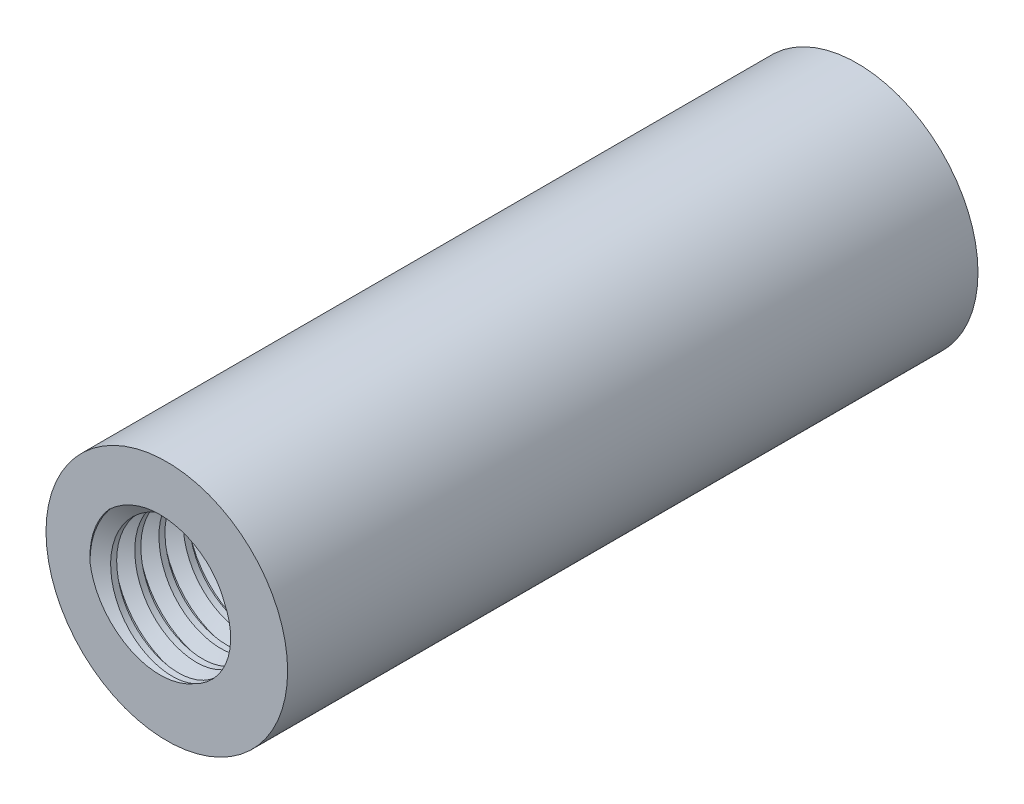
from build123d import *

# Parameters (mm, degrees)
SKETCH_1_R          = 3.5
EXTRUDE_1_DEPTH     = 20
M4X0_7_HELICOIL_1_D = 3.7
THREAD_1_PITCH      = 0.7


with BuildPart() as part:
    # Sketch 1 → 보스-돌출1 (new body)
    with BuildSketch(Plane.XY):
        Circle(SKETCH_1_R)
    extrude(amount=EXTRUDE_1_DEPTH)

    # M4x0.7 Helicoil용 탭 구멍1 (through all)
    with Locations(Plane.XY.offset(20)):
        with Locations((0, 0)):
            Hole(M4X0_7_HELICOIL_1_D / 2)

    # 나사산1: the profile of Sketch 1 2 profile screwed along a right-hand helix of 35.714286 turns, 6 arcs to a turn; built about Z, then put on its axis
    thread_1_z = Axis((0, 0, 0), (0, 0, 1))
    thread_1_corners = [(1.8497, 0, -0.000173205), (2.228886112, 0, 0.218749999), (2.228886112, 0, 0.306249999), (1.8497, 0, 0.525173203)]
    with BuildLine(mode=Mode.PRIVATE) as thread_1_profile:
        Line(thread_1_corners[0], thread_1_corners[1])
        Line(thread_1_corners[1], thread_1_corners[2])
        Line(thread_1_corners[2], thread_1_corners[3])
        Line(thread_1_corners[3], thread_1_corners[0])
    thread_1_cap = Face(thread_1_profile.wire())
    thread_1_turn_angles = [0, 30, 60, 90, 120, 150, 180, 210, 240, 270, 300, 330, 360]
    thread_1_turn_weights = [1, 0.8660254037844387, 1, 0.8660254037844387, 1, 0.8660254037844387, 1, 0.8660254037844387, 1, 0.8660254037844387, 1, 0.8660254037844387, 1]
    thread_1_turn_rails = [Edge.make_bspline([Vector(p[0], p[1], 0).rotate(thread_1_z, thread_1_turn_angles[k]) / thread_1_turn_weights[k] + Vector(0, 0, p[2] + THREAD_1_PITCH * thread_1_turn_angles[k] / 360) for k in range(13)], [0, 0, 0, 1, 1, 2, 2, 3, 3, 4, 4, 5, 5, 6, 6, 6], 2, thread_1_turn_weights) for p in thread_1_corners]
    thread_1_turn_sides = [Face.make_surface_from_curves(thread_1_turn_rails[p[0]], thread_1_turn_rails[p[1]]) for p in [(0, 1), (1, 2), (2, 3), (3, 0)]]
    thread_1_last_angles = [12600, 12630, 12660, 12690, 12720, 12750, 12780, 12810, 12840, 12848.571428571, 12857.142857143]
    thread_1_last_weights = [1, 0.8660254037844387, 1, 0.8660254037844387, 1, 0.8660254037844387, 1, 0.8660254037844387, 1, 0.9888308262251265, 1]
    thread_1_last_rails = [Edge.make_bspline([Vector(p[0], p[1], 0).rotate(thread_1_z, thread_1_last_angles[k]) / thread_1_last_weights[k] + Vector(0, 0, p[2] + THREAD_1_PITCH * thread_1_last_angles[k] / 360) for k in range(11)], [0, 0, 0, 1, 1, 2, 2, 3, 3, 4, 4, 5, 5, 5], 2, thread_1_last_weights) for p in thread_1_corners]
    thread_1_last_sides = [Face.make_surface_from_curves(thread_1_last_rails[p[0]], thread_1_last_rails[p[1]]) for p in [(0, 1), (1, 2), (2, 3), (3, 0)]]
    thread_1 = Plane(origin=(0, 0, 21), x_dir=(-1, 0, 0), z_dir=(0, 0, -1)) * Solid(Shell([*[p.moved(Location((0, 0, THREAD_1_PITCH * i))) for i in range(35) for p in thread_1_turn_sides], *thread_1_last_sides, thread_1_cap, thread_1_cap.rotate(thread_1_z, 12857.142857143).moved(Location((0, 0, THREAD_1_PITCH * 12857.142857143 / 360)))]))
    add(thread_1, mode=Mode.SUBTRACT)


solid = part.part
